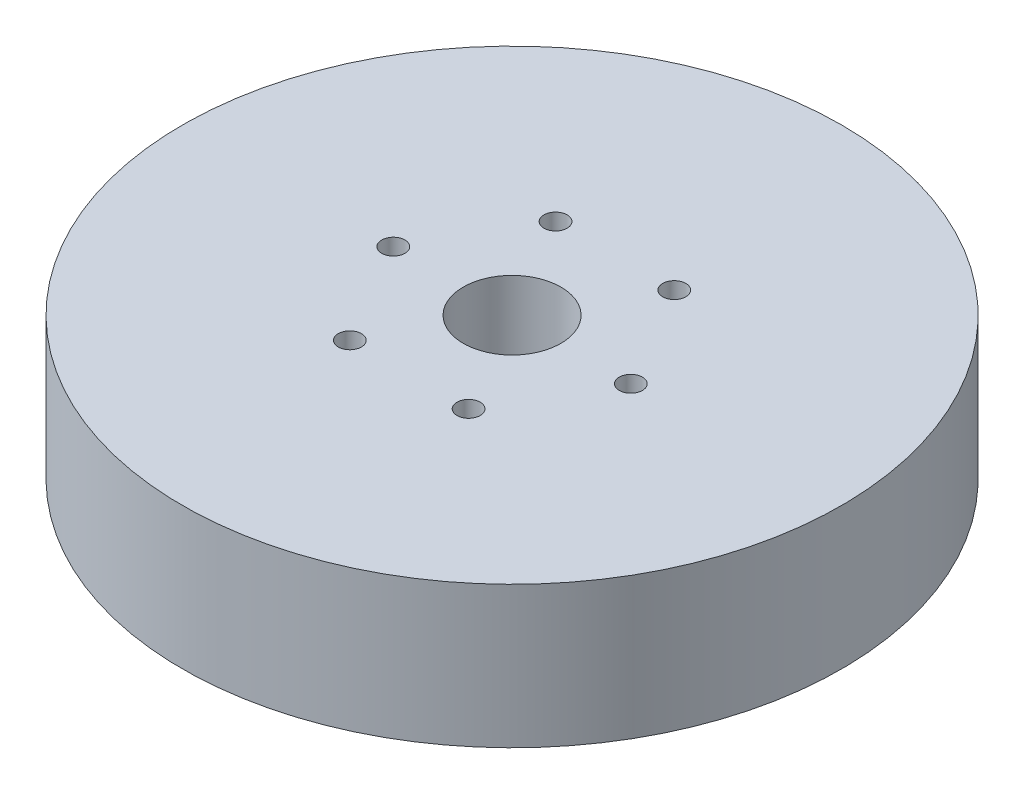
from build123d import *

# Parameters (mm, degrees)
SKETCH1_R           = 67.5
BOSS_EXTRUDE1_DEPTH = 29
SKETCH2_R           = 10
CUT_EXTRUDE1_DEPTH  = 100.767229089
SKETCH3_R           = 2.375106061
CUT_EXTRUDE2_DEPTH  = 18.40236066
CIRPATTERN1_COUNT   = 6


with BuildPart() as part:
    # Sketch1 → Boss-Extrude1 (new body)
    with BuildSketch(Plane(origin=(0, 0, 0), x_dir=(1, 0, 0), z_dir=(0, 1, 0))):
        Circle(SKETCH1_R)
    extrude(amount=BOSS_EXTRUDE1_DEPTH)

    # Sketch2 → Cut-Extrude1 (cut, through all)
    with BuildSketch(Plane(origin=(0, 0, 0), x_dir=(1, 0, 0), z_dir=(0, 1, 0))):
        Circle(SKETCH2_R)
    extrude(amount=CUT_EXTRUDE1_DEPTH, mode=Mode.SUBTRACT)

    # Sketch3 → Cut-Extrude2 (cut)
    with BuildSketch(Plane(origin=(0, 29, 0), x_dir=(1, 0, 0), z_dir=(0, 1, 0))):
        with Locations((-24.322467229, 0)):
            Circle(SKETCH3_R)
    cut_extrude2 = extrude(amount=-CUT_EXTRUDE2_DEPTH, mode=Mode.SUBTRACT)

    # CirPattern1: Cut-Extrude2 ×6 about axis
    cirpattern1_axis = Axis((0, 0, 0), (0, 1, 0))
    for i in range(1, CIRPATTERN1_COUNT):
        add(cut_extrude2.rotate(cirpattern1_axis, i * 360 / CIRPATTERN1_COUNT), mode=Mode.SUBTRACT)


solid = part.part
